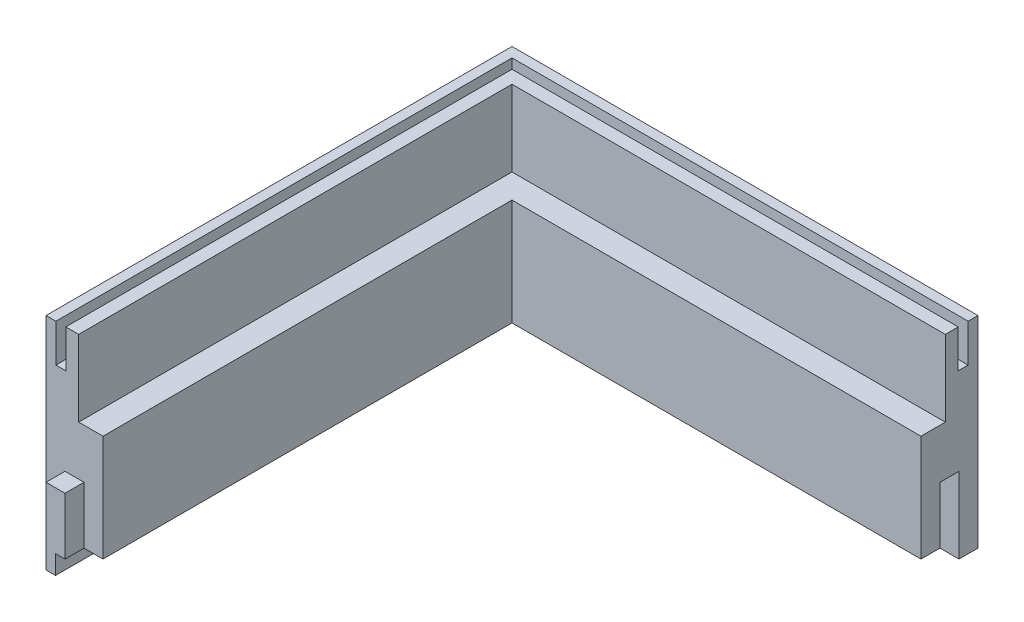
from build123d import *

# Parameters (mm, degrees)
BOSS_EXTRUDE5_DEPTH     = 67.31
CUT_EXTRUDE2_DEPTH      = 12.693340834
CUT_EXTRUDE3_DEPTH      = 25.4
SKETCH11_W              = 6.35
SKETCH11_H              = 25.4
BOSS_EXTRUDE6_DEPTH     = 6.35
SKETCH12_W              = 6.35
SKETCH12_H              = 25.4
CUT_EXTRUDE4_DEPTH      = 6.35
CUT_EXTRUDE5_DEPTH      = 171.430214526
CUT_EXTRUDE5_DEPTH_BACK = 6.35


with BuildPart() as part:
    # Sketch1 → Boss-Extrude5 (new body)
    with BuildSketch(Plane(origin=(0, 0, 0), x_dir=(1, 0, 0), z_dir=(0, 1, 0))):
        Polygon((-60.605605599, 37.663504972), (95.096394401, 37.663504972), (95.096394401, 18.613504972), (-41.555605599, 18.613504972), (-41.555605599, -118.038495028), (-60.605605599, -118.038495028), align=None)
    extrude(amount=BOSS_EXTRUDE5_DEPTH)

    # Sketch8 → Cut-Extrude2 (cut)
    with BuildSketch(Plane(origin=(0, 67.31, 0), x_dir=(1, 0, 0), z_dir=(0, 1, 0))):
        Polygon((-57.303605599, -118.038495028), (-57.303605599, 34.361504972), (95.096394401, 34.361504972), (95.096394401, 31.059504972), (-54.001605599, 31.059504972), (-54.001605599, -118.038495028), align=None)
    extrude(amount=-CUT_EXTRUDE2_DEPTH, mode=Mode.SUBTRACT)

    # Sketch9 → Cut-Extrude3 (cut)
    with BuildSketch(Plane(origin=(0, 67.31, 0), x_dir=(1, 0, 0), z_dir=(0, 1, 0))):
        Polygon((-49.683605599, -118.038495028), (-49.683605599, 26.741504972), (95.096394401, 26.741504972), (95.096394401, 18.613504972), (-41.555605599, 18.613504972), (-41.555605599, -118.038495028), align=None)
    extrude(amount=-CUT_EXTRUDE3_DEPTH, mode=Mode.SUBTRACT)

    # Sketch11 → Boss-Extrude6 (add)
    with BuildSketch(Plane.XY.offset(118.038495028)):
        with Locations((-51.080605599, 12.7)):
            Rectangle(SKETCH11_W, SKETCH11_H)
    extrude(amount=BOSS_EXTRUDE6_DEPTH)

    # Sketch12 → Cut-Extrude4 (cut)
    with BuildSketch(Plane(origin=(95.096394401, 0, 0), x_dir=(0, 0, -1), z_dir=(1, 0, 0))):
        with Locations((28.138504972, 12.7)):
            Rectangle(SKETCH12_W, SKETCH12_H)
    extrude(amount=-CUT_EXTRUDE4_DEPTH, mode=Mode.SUBTRACT)

    # Sketch13 → Cut-Extrude5 (cut, two sides: drawn at the far end of the back side and taken through both)
    with BuildSketch(Plane.XZ.offset(-CUT_EXTRUDE5_DEPTH_BACK)):
        Polygon((-51.080605599, 570.867892173), (-51.080605599, 124.388495028), (-51.080605599, -25.399651713), (-51.080605599, -28.138504972), (88.746394401, -28.138504972), (535.225791546, -28.138504972), (1173.371683532, 596.477560176), (587.065286387, 1195.483957321), align=None)
    extrude(amount=CUT_EXTRUDE5_DEPTH + CUT_EXTRUDE5_DEPTH_BACK, mode=Mode.SUBTRACT)


solid = part.part
